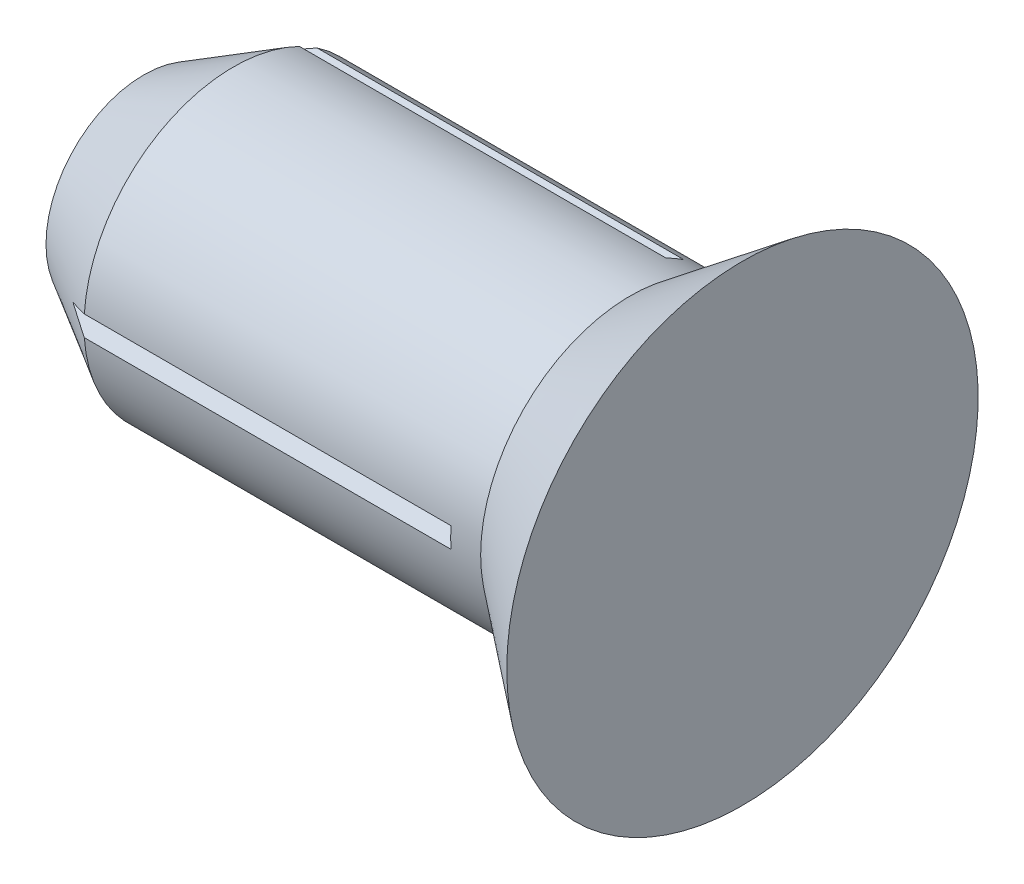
from build123d import *

# Parameters (mm, degrees)
CUT_EXTRUDE1_DEPTH = 30.506454095
CIRPATTERN1_COUNT  = 3


with BuildPart() as part:
    # Sketch1 → Base-Revolve (revolve)
    with BuildSketch(Plane.XY):
        Polygon((-32.506454106, 0), (-32.506454106, 6.535898385), (-26.506454106, 10), (0, 10), (7.493545894, 15.75), (7.493545894, 0), align=None)
    revolve(axis=Axis((-40, 0, 0), (1, 0, 0)))

    # Sketch2 → Cut-Extrude1 (cut)
    with BuildSketch(Plane.ZY.offset(32.506454106)):
        Polygon((9, 0), (10, 0.700207538), (10, -0.700207538), align=None)
    cut_extrude1 = extrude(amount=-CUT_EXTRUDE1_DEPTH, mode=Mode.SUBTRACT)

    # CirPattern1: Cut-Extrude1 ×3 about axis
    cirpattern1_axis = Axis((-40, 0, 0), (1, 0, 0))
    for i in range(1, CIRPATTERN1_COUNT):
        add(cut_extrude1.rotate(cirpattern1_axis, i * 360 / CIRPATTERN1_COUNT), mode=Mode.SUBTRACT)


solid = part.part
